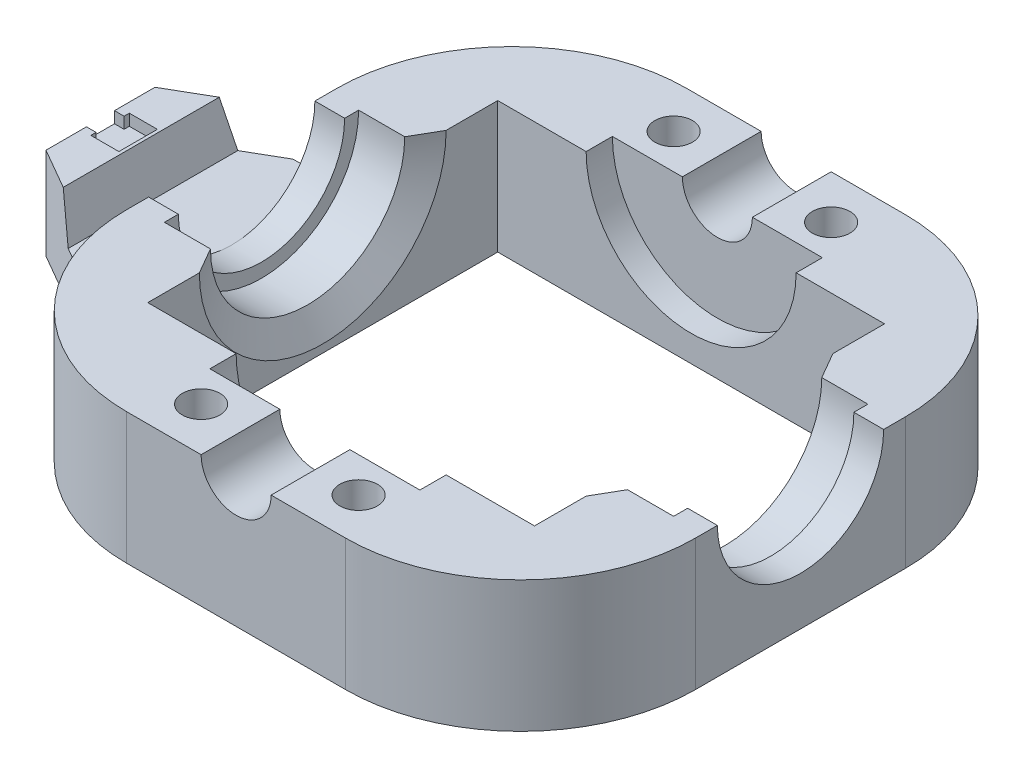
from build123d import *
from OCP.BRepFilletAPI import BRepFilletAPI_MakeChamfer

# Parameters (mm, degrees)
SKETCH1_W           = 65
SKETCH1_H           = 64
SKETCH1_W_2         = 44.2
SKETCH1_H_2         = 40
BOSS_EXTRUDE1_DEPTH = 15
SKETCH3_W           = 7
SKETCH3_H           = 11.1
SKETCH4_R           = 9.5
CUT_EXTRUDE2_DEPTH  = 74.986485252
SKETCH5_R           = 4
CUT_EXTRUDE3_DEPTH  = 74.32973476
SKETCH8_R           = 2.15
CUT_EXTRUDE6_DEPTH  = 49.013019068
FILLET1_R           = 20
CHAMFER1_SIZE       = 3
CHAMFER1_SIZE2      = 1.732050808
SKETCH9_W           = 12
SKETCH9_H           = 3
SKETCH10_W          = 24
SKETCH10_H          = 5.5
BOSS_EXTRUDE2_DEPTH = 15
BOSS_EXTRUDE3_START = 9
SKETCH12_W          = 24
SKETCH12_H          = 3.7
BOSS_EXTRUDE3_DEPTH = 6
BOSS_EXTRUDE4_DEPTH = 1.3
CHAMFER2_SIZE2      = 1.339745962
CHAMFER2_SIZE       = 5
CHAMFER3_SIZE       = 10
CHAMFER3_SIZE2      = 5.773502692


with BuildPart() as part:
    # Sketch1 → Boss-Extrude1 (new body)
    with BuildSketch(Plane(origin=(0, 0, 0), x_dir=(1, 0, 0), z_dir=(0, 1, 0))):
        Rectangle(SKETCH1_W, SKETCH1_H)
        Rectangle(SKETCH1_W_2, SKETCH1_H_2, mode=Mode.SUBTRACT)
    extrude(amount=BOSS_EXTRUDE1_DEPTH)

    # Sketch3 → Cut-Revolve1 (revolve, cut)
    with BuildSketch(Plane(origin=(0, 15, 0), x_dir=(1, 0, 0), z_dir=(0, 1, 0))):
        with Locations((25.6, -5.55)):
            Rectangle(SKETCH3_W, SKETCH3_H)
        with Locations((-25.6, -5.55)):
            Rectangle(SKETCH3_W, SKETCH3_H)
    revolve(axis=Axis((22.1, 15, 0), (1, 0, 0)), mode=Mode.SUBTRACT)

    # Sketch4 → Cut-Extrude2 (cut, through all)
    with BuildSketch(Plane(origin=(32.5, 0, 0), x_dir=(0, 0, -1), z_dir=(1, 0, 0))):
        with Locations((0, 15)):
            Circle(SKETCH4_R)
    extrude(amount=-CUT_EXTRUDE2_DEPTH, mode=Mode.SUBTRACT)

    # Sketch5 → Cut-Extrude3 (cut, through all)
    with BuildSketch(Plane.XY.offset(32)):
        with Locations((0, 15)):
            Circle(SKETCH5_R)
    extrude(amount=-CUT_EXTRUDE3_DEPTH, mode=Mode.SUBTRACT)

    # Sketch8 → Cut-Extrude6 (cut, through all)
    with BuildSketch(Plane(origin=(0, 15, 0), x_dir=(1, 0, 0), z_dir=(0, 1, 0))):
        with Locations((18, 16.5)):
            Circle(SKETCH8_R)
        with Locations((18, -16.5)):
            Circle(SKETCH8_R)
        with Locations((-18, -16.5)):
            Circle(SKETCH8_R)
        with Locations((-18, 16.5)):
            Circle(SKETCH8_R)
        with Locations(Location((9, -27, 0), (0, 0, 270))):
            Circle(SKETCH8_R)
        with Locations(Location((-9, -27, 0), (0, 0, 270))):
            Circle(SKETCH8_R)
        with Locations(Location((-9, 27, 0), (0, 0, 270))):
            Circle(SKETCH8_R)
        with Locations(Location((9, 27, 0), (0, 0, 270))):
            Circle(SKETCH8_R)
    extrude(amount=-CUT_EXTRUDE6_DEPTH, mode=Mode.SUBTRACT)

    # Fillet1
    fillet1_edges = [part.edges().sort_by_distance(p)[0] for p in [
        (-32.5, 7.5, -32),
        (32.5, 7.5, -32),
        (32.5, 7.5, 32),
        (-32.5, 7.5, 32),
    ]]
    fillet(fillet1_edges, radius=FILLET1_R)

    # Chamfer1: one chamfer whose edges measure the first distance from different faces: ONE call of the kernel's chamfer builder (chamfer() names one face for all edges)
    chamfer1_edges_1 = [part.edges().sort_by_distance(p)[0] for p in [
        (22.1, 3.9, 0),
    ]]
    chamfer1_side_1 = [part.faces().sort_by_distance(p)[0] for p in [
        (22.1, 0.427200187, 0),
    ]]
    chamfer1_edges_2 = [part.edges().sort_by_distance(p)[0] for p in [
        (-22.1, 3.9, 0),
    ]]
    chamfer1_side_2 = [part.faces().sort_by_distance(p)[0] for p in [
        (-22.1, 0.427200187, 0),
    ]]
    chamfer1 = BRepFilletAPI_MakeChamfer(part.part.solid().wrapped)
    for e in chamfer1_edges_1:
        chamfer1.Add(CHAMFER1_SIZE, CHAMFER1_SIZE2, e.wrapped, chamfer1_side_1[0].wrapped)  # the first distance lies on this face
    for e in chamfer1_edges_2:
        chamfer1.Add(CHAMFER1_SIZE, CHAMFER1_SIZE2, e.wrapped, chamfer1_side_2[0].wrapped)  # the first distance lies on this face
    add(Compound.cast(chamfer1.Shape()), mode=Mode.REPLACE)

    # Sketch9 → Cut-Revolve2 (revolve, cut)
    with BuildSketch(Plane(origin=(0, 15, 0), x_dir=(1, 0, 0), z_dir=(0, 1, 0))):
        with Locations((-6, -21.5)):
            Rectangle(SKETCH9_W, SKETCH9_H)
        with Locations((-6, 21.5)):
            Rectangle(SKETCH9_W, SKETCH9_H)
    revolve(axis=Axis((0, 15, -29.871415895), (0, 0, 1)), mode=Mode.SUBTRACT)

    # Sketch10 → Boss-Extrude2 (add)
    with BuildSketch(Plane.ZY.offset(32.5)):
        with Locations((0, 2.75)):
            Rectangle(SKETCH10_W, SKETCH10_H)
    extrude(amount=BOSS_EXTRUDE2_DEPTH)

    # Sketch12 → Boss-Extrude3 (add)
    with BuildSketch(Plane.ZY.offset(32.5).offset(BOSS_EXTRUDE3_START)):
        with Locations((0, 7.35)):
            Rectangle(SKETCH12_W, SKETCH12_H)
    extrude(amount=BOSS_EXTRUDE3_DEPTH)

    # Sketch13 → Boss-Extrude4 (add)
    with BuildSketch(Plane(origin=(0, 9.2, 0), x_dir=(1, 0, 0), z_dir=(0, 1, 0))):
        Polygon((-46.4, 2.2), (-46.4, 1.6), (-47.5, 1.6), (-47.5, 12), (-41.5, 12), (-41.5, -12), (-47.5, -12), (-47.5, -1.6), (-46.4, -1.6), (-46.4, -2.2), (-43.2, -2.2), (-43.2, 2.2), align=None)
    extrude(amount=BOSS_EXTRUDE4_DEPTH)

    # Chamfer2
    chamfer2_edges = [part.edges().sort_by_distance(p)[0] for p in [
        (-41.5, 10.5, 0),
    ]]
    chamfer2_side = [part.faces().sort_by_distance(p)[0] for p in [
        (-41.5, 10.473205081, 0),
    ]]
    chamfer(chamfer2_edges, length=CHAMFER2_SIZE - 0.0001, length2=CHAMFER2_SIZE2 - 0.0001, reference=chamfer2_side[0])  # a hair under: the kernel refuses the full size

    # Chamfer3: one chamfer whose edges measure the first distance from different faces: ONE call of the kernel's chamfer builder (chamfer() names one face for all edges)
    chamfer3_edges_1 = [part.edges().sort_by_distance(p)[0] for p in [
        (-47.5, 5.25, 12),
    ]]
    chamfer3_side_1 = [part.faces().sort_by_distance(p)[0] for p in [
        (-41.177093858, 4.00630158, 12),
    ]]
    chamfer3_edges_2 = [part.edges().sort_by_distance(p)[0] for p in [
        (-47.5, 5.25, -12),
    ]]
    chamfer3_side_2 = [part.faces().sort_by_distance(p)[0] for p in [
        (-41.177093858, 4.00630158, -12),
    ]]
    chamfer3 = BRepFilletAPI_MakeChamfer(part.part.solid().wrapped)
    for e in chamfer3_edges_1:
        chamfer3.Add(CHAMFER3_SIZE, CHAMFER3_SIZE2, e.wrapped, chamfer3_side_1[0].wrapped)  # the first distance lies on this face
    for e in chamfer3_edges_2:
        chamfer3.Add(CHAMFER3_SIZE, CHAMFER3_SIZE2, e.wrapped, chamfer3_side_2[0].wrapped)  # the first distance lies on this face
    add(Compound.cast(chamfer3.Shape()), mode=Mode.REPLACE)


solid = part.part
